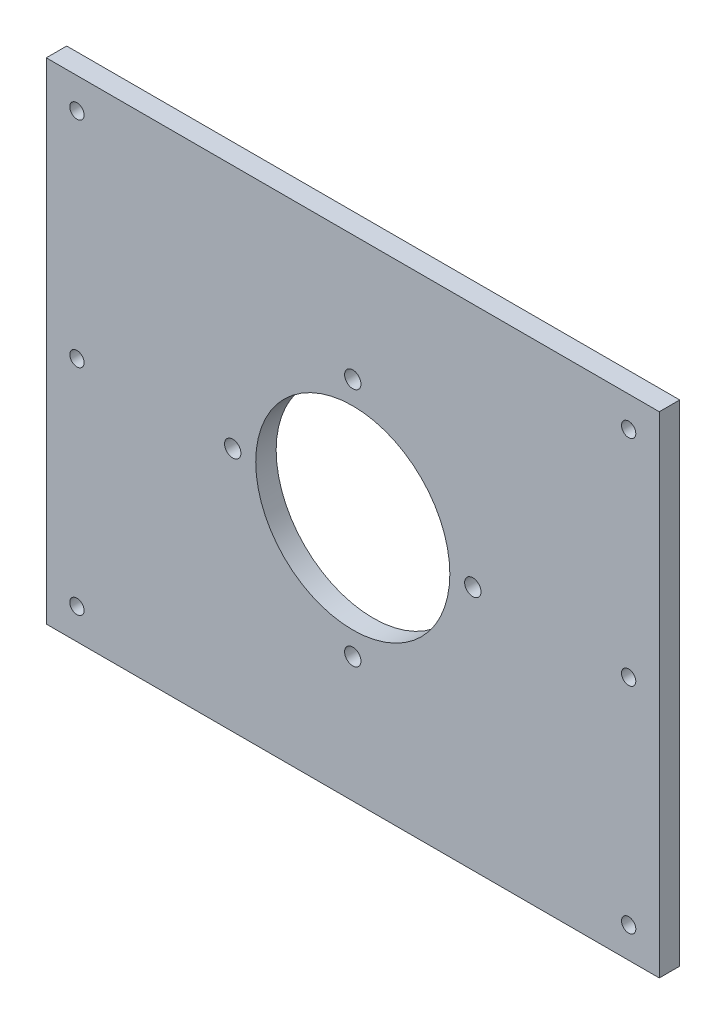
from build123d import *

# Parameters (mm, degrees)
SKETCH1_W               = 381
SKETCH1_H               = 304.8
BOSS_EXTRUDE1_DEPTH     = 12.7
CUT_EXTRUDE1_DEPTH      = 94.996
CUT_EXTRUDE1_DEPTH_BACK = 157.226
SKETCH2_R               = 5.08
SKETCH2_R_2             = 60.325
SKETCH2_R_3             = 4.445


with BuildPart() as part:
    # Sketch1 → Boss-Extrude1 (new body)
    with BuildSketch(Plane.XY):
        with Locations((21.951655629, 19.428476821)):
            Rectangle(SKETCH1_W, SKETCH1_H)
    extrude(amount=BOSS_EXTRUDE1_DEPTH)

    # Sketch2 → Cut-Extrude1 (cut, two sides: drawn at the far end of the back side and taken through both)
    with BuildSketch(Plane(origin=(0, 0, 0), x_dir=(-1, 0, 0), z_dir=(0, 0, -1)).offset(-CUT_EXTRUDE1_DEPTH_BACK)):
        with Locations((-96.551655629, 19.428476821)):
            Circle(SKETCH2_R)
        with Locations((-21.951655629, 19.428476821)):
            Circle(SKETCH2_R_2)
        with Locations((-21.951655629, 94.028476821)):
            Circle(SKETCH2_R)
        with Locations((-21.951655629, -55.171523179)):
            Circle(SKETCH2_R)
        with Locations((52.648344371, 19.428476821)):
            Circle(SKETCH2_R)
        with Locations((-193.401655629, 152.778476821)):
            Circle(SKETCH2_R_3)
        with Locations((-193.401655629, -113.921523179)):
            Circle(SKETCH2_R_3)
        with Locations((149.498344371, -113.921523179)):
            Circle(SKETCH2_R_3)
        with Locations((149.498344371, 152.778476821)):
            Circle(SKETCH2_R_3)
        with Locations((-193.401655629, 19.428476821)):
            Circle(SKETCH2_R_3)
        with Locations((149.498344371, 19.428476821)):
            Circle(SKETCH2_R_3)
    extrude(amount=CUT_EXTRUDE1_DEPTH + CUT_EXTRUDE1_DEPTH_BACK, mode=Mode.SUBTRACT)


solid = part.part
